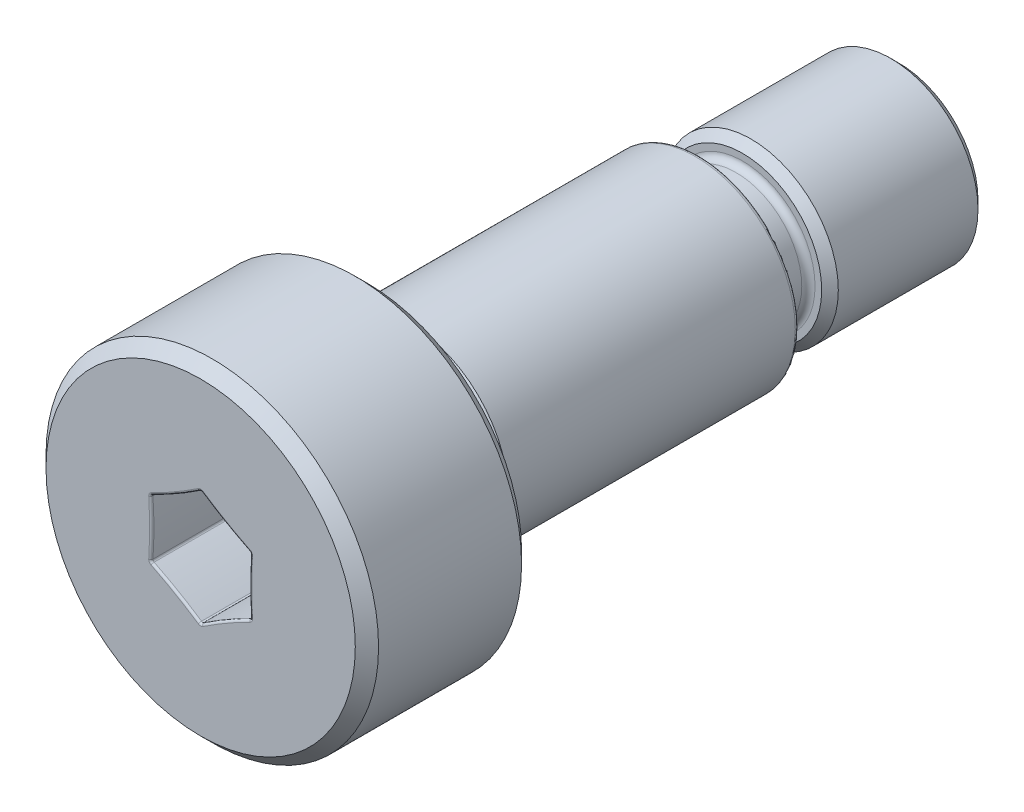
from build123d import *

# Parameters (mm, degrees)
SKETCH4_W          = 0.9921875
SKETCH4_H          = 0.3571875
SKETCH4_W_2        = 1.031875
SKETCH4_H_2        = 0.515555748
CHAMFER1_SIZE      = 0.3571875
FILLET1_R          = 0.17859375
FILLET2_R          = 0.15875
CHAMFER2_SIZE      = 0.1984375
FILLET3_R          = 0.09525
CHAMFER3_SIZE      = 0.2778125
CUT_EXTRUDE1_DEPTH = 2.0828
FILLET4_R          = 0.0508


with BuildPart() as part:
    # Sketch3 → Revolve1 (revolve)
    with BuildSketch(Plane(origin=(0, 0, 0), x_dir=(0, 0, -1), z_dir=(1, 0, 0)), mode=Mode.PRIVATE) as revolve1_sk:
        Polygon((-3.96875, 3.96875), (0, 3.96875), (0, 2.38125), (7.9375, 2.38125), (7.9375, 2.0828), (12.7, 2.0828), (12.7, 0), (-3.96875, 0), align=None)
    revolve(revolve1_sk.sketch.rotate(Axis((0, 0, 3.96875), (0, 0, -1)), 90), axis=Axis((0, 0, 3.96875), (0, 0, -1)))

    # Sketch4 → Cut-Revolve1 (revolve, cut)
    with BuildSketch(Plane(origin=(0, 0, 0), x_dir=(0, 0, -1), z_dir=(1, 0, 0)), mode=Mode.PRIVATE) as cut_revolve1_sk:
        with Locations((0.49609375, 2.20265625)):
            Rectangle(SKETCH4_W, SKETCH4_H)
        with Locations((8.4534375, 1.825022126)):
            Rectangle(SKETCH4_W_2, SKETCH4_H_2)
    revolve(cut_revolve1_sk.sketch.rotate(Axis((0, 0, 3.96875), (0, 0, -1)), 90), axis=Axis((0, 0, 3.96875), (0, 0, -1)), mode=Mode.SUBTRACT)

    # Chamfer1
    chamfer1_edges = [part.edges().sort_by_distance(p)[0] for p in [
        (-2.0240625, 0, -0.9921875),
    ]]
    chamfer(chamfer1_edges, length=CHAMFER1_SIZE - 0.0001)  # a hair under: the kernel refuses the full size

    # Fillet1
    fillet1_edges = [part.edges().sort_by_distance(p)[0] for p in [
        (-2.0240625, 0, 0),
    ]]
    fillet(fillet1_edges, radius=FILLET1_R)

    # Fillet2
    fillet2_edges = [part.edges().sort_by_distance(p)[0] for p in [
        (-1.567244252, 0, -7.9375),
        (-1.567244252, 0, -8.969375),
    ]]
    fillet(fillet2_edges, radius=FILLET2_R)

    # Chamfer2
    chamfer2_edges = [part.edges().sort_by_distance(p)[0] for p in [
        (-2.0828, 0, -8.969375),
        (-2.0828, 0, -12.7),
    ]]
    chamfer(chamfer2_edges, length=CHAMFER2_SIZE)

    # Fillet3
    fillet3_edges = [part.edges().sort_by_distance(p)[0] for p in [
        (-2.38125, 0, -7.9375),
    ]]
    fillet(fillet3_edges, radius=FILLET3_R)

    # Chamfer3
    chamfer3_edges = [part.edges().sort_by_distance(p)[0] for p in [
        (-3.96875, 0, 0),
        (-3.96875, 0, 3.96875),
    ]]
    chamfer(chamfer3_edges, length=CHAMFER3_SIZE)

    # Sketch5 → Cut-Extrude1 (cut)
    with BuildSketch(Plane.XY.offset(3.96875)):
        with BuildLine():
            ThreePointArc((1.190625, 0.687407664), (0.58340625, 1.010489266), (0, 1.374815329))
            ThreePointArc((0, 1.374815329), (-0.58340625, 1.010489266), (-1.190625, 0.687407664))
            ThreePointArc((-1.190625, 0.687407664), (-1.1668125, 0), (-1.190625, -0.687407664))
            ThreePointArc((-1.190625, -0.687407664), (-0.58340625, -1.010489266), (0, -1.374815329))
            ThreePointArc((0, -1.374815329), (0.58340625, -1.010489266), (1.190625, -0.687407664))
            ThreePointArc((1.190625, -0.687407664), (1.1668125, 0), (1.190625, 0.687407664))
        make_face()
    extrude(amount=-CUT_EXTRUDE1_DEPTH, mode=Mode.SUBTRACT)

    # Fillet4
    fillet4_edges = [part.edges().sort_by_distance(p)[0] for p in [
        (1.1668125, 0, 1.88595),
        (1.190625, 0.687407664, 2.92735),
        (0.58340625, -1.010489266, 1.88595),
        (1.190625, -0.687407664, 2.92735),
        (-0.58340625, -1.010489266, 1.88595),
        (0, -1.374815329, 2.92735),
        (-1.1668125, 0, 1.88595),
        (-1.190625, -0.687407664, 2.92735),
        (-0.58340625, 1.010489266, 1.88595),
        (-1.190625, 0.687407664, 2.92735),
        (0.58340625, 1.010489266, 1.88595),
        (0, 1.374815329, 2.92735),
        (1.1668125, 0, 3.96875),
        (0.58340625, 1.010489266, 3.96875),
        (-0.58340625, 1.010489266, 3.96875),
        (-1.1668125, 0, 3.96875),
        (-0.58340625, -1.010489266, 3.96875),
        (0.58340625, -1.010489266, 3.96875),
    ]]
    fillet(fillet4_edges, radius=FILLET4_R)


solid = part.part
